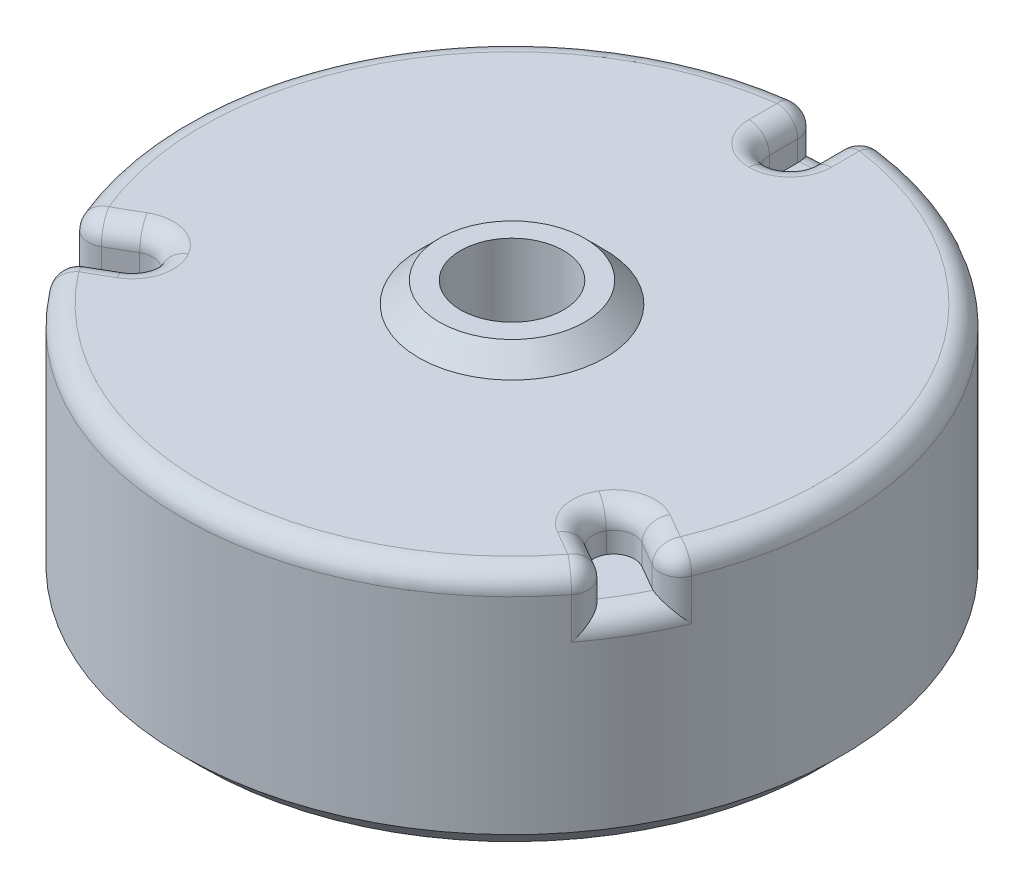
from build123d import *

# Parameters (mm, degrees)
SKETCH_1_R                       = 80
SKETCH_1_R_2                     = 12.5
EXTRUDE_1_DEPTH                  = 60
SKETCH_2_R                       = 22.637861394
SKETCH_2_R_2                     = 12.5
EXTRUDE_2_DEPTH                  = 5
CHAMFER_1_SIZE                   = 5
CHAMFER_2_SIZE                   = 5
SKETCH_3_W                       = 10
SKETCH_3_H                       = 35
CUT_EXTRUDE_1_DEPTH              = 10
FILLET_1_R                       = 5
PATTERN_CIRCULAR_1_COUNT         = 3
FILLET_1_OF_PATTERN_CIRCULAR_1_R = 5
FILLET_2_R                       = 5


# Some blends are built 0.0001 mm under size
with BuildPart() as part:
    # 草图1 → 凸台-拉伸1 (new body)
    with BuildSketch(Plane(origin=(0, 0, 0), x_dir=(1, 0, 0), z_dir=(0, 1, 0))):
        with Locations(Location((0, 0, 0), (0, 0, 270))):
            Circle(SKETCH_1_R)
        with Locations(Location((0, 0, 0), (0, 0, 270))):
            Circle(SKETCH_1_R_2, mode=Mode.SUBTRACT)
    extrude(amount=EXTRUDE_1_DEPTH)

    # 草图2 → 凸台-拉伸2 (add)
    with BuildSketch(Plane(origin=(0, 60, 0), x_dir=(1, 0, 0), z_dir=(0, 1, 0))):
        with Locations(Location((0, 0, 0), (0, 0, 270))):
            Circle(SKETCH_2_R)
        with Locations(Location((0, 0, 0), (0, 0, 270))):
            Circle(SKETCH_2_R_2, mode=Mode.SUBTRACT)
    extrude(amount=EXTRUDE_2_DEPTH)

    # 倒角1
    chamfer_1_edges = [part.edges().sort_by_distance(p)[0] for p in [
        (0, 65, -22.637861394),
    ]]
    chamfer(chamfer_1_edges, length=CHAMFER_1_SIZE - 0.0001)  # a hair under: the kernel refuses the full size

    # 倒角2
    chamfer_2_edges = [part.edges().sort_by_distance(p)[0] for p in [
        (0, 0, -80),
    ]]
    chamfer(chamfer_2_edges, length=CHAMFER_2_SIZE)

    # 草图3 → 切除-拉伸1 (cut)
    with BuildSketch(Plane(origin=(0, 60, 0), x_dir=(1, 0, 0), z_dir=(0, 1, 0))):
        with Locations((0, 80)):
            Rectangle(SKETCH_3_W, SKETCH_3_H)
    cut_extrude_1 = extrude(amount=-CUT_EXTRUDE_1_DEPTH, mode=Mode.SUBTRACT)

    # 圆角1
    # the kernel refuses this fillet: 5 mm, written as the material it adds along each edge
    with BuildSketch(Plane(origin=(5, 60, -62.5), x_dir=(0, 0, -1), z_dir=(0, -1, 0))) as fillet_1_piece_1:
        with BuildLine():
            CenterArc((FILLET_1_R, -FILLET_1_R), FILLET_1_R, 90, 90)
            Line((0, -FILLET_1_R), (0, 0))
            Line((0, 0), (FILLET_1_R, 0))
        make_face()
    extrude(amount=22.5)
    with BuildSketch(Plane(origin=(-5, 60, -62.5), x_dir=(0, 0, -1), z_dir=(0, -1, 0))) as fillet_1_piece_2:
        with BuildLine():
            CenterArc((FILLET_1_R, FILLET_1_R), FILLET_1_R, 180, 90)
            Line((0, FILLET_1_R), (0, 0))
            Line((0, 0), (FILLET_1_R, 0))
        make_face()
    extrude(amount=22.5)
    # the kernel refuses this fillet: 5 mm, written as the material it takes off along each edge
    with BuildSketch(Plane(origin=(0, 50, 0), x_dir=(-0.21704975973433055, 0, -0.9761605409968533), z_dir=(-0.9761605409968533, 0, 0.21704975973433055))) as fillet_1_2_piece_1_section:
        with BuildLine():
            CenterArc((80 - FILLET_1_R, FILLET_1_R), FILLET_1_R, 270, 90)
            Line((80 - FILLET_1_R, 0), (80, 0))
            Line((80, 0), (80, FILLET_1_R))
        make_face()
    fillet_1_2_piece_1 = revolve(axis=Axis((0, 50, 0), (0, -1, 0)), revolution_arc=25.071620089, mode=Mode.PRIVATE)
    fillet_1_2_piece_1 = split(fillet_1_2_piece_1, bisect_by=Plane(origin=(5, 48.868036462, -78.815102538), z_dir=(-1, 0, 0)), keep=Keep.TOP, mode=Mode.PRIVATE)
    fillet_1_2_piece_1 = split(fillet_1_2_piece_1, bisect_by=Plane(origin=(-5, 48.868036462, -78.815102538), z_dir=(1, 0, 0)), keep=Keep.TOP, mode=Mode.PRIVATE)
    add(fillet_1_2_piece_1, mode=Mode.SUBTRACT)
    with BuildSketch(Plane(origin=(5, 74.235159008, -79.843597113), x_dir=(0.995188508885034, 0, 0.09797873127971658), z_dir=(0, -1, 0))) as fillet_1_2_piece_2:
        with BuildLine():
            CenterArc((5.516124116, 4.996832751), FILLET_1_R, 174.37721132, 97.662255661)
            Line((0.540181571, 5.486726407), (0, 0))
            ThreePointArc((0, 0), (2.847031802, -0.050675988), (5.694063603, 0))
        make_face()
    extrude(amount=24.235159008, mode=Mode.SUBTRACT)
    with BuildSketch(Plane(origin=(-5, 74.235159008, -79.843597113), x_dir=(-0.9951885088850337, 0, 0.09797873127971717), z_dir=(0, -1, 0))) as fillet_1_2_piece_3:
        with BuildLine():
            CenterArc((5.516124116, -4.996832751), FILLET_1_R, 87.960533019, 97.662255661)
            Line((0.540181571, -5.486726407), (0, 0))
            ThreePointArc((0, 0), (2.847031802, 0.050675988), (5.694063603, 0))
        make_face()
    extrude(amount=24.235159008, mode=Mode.SUBTRACT)
    with BuildSketch(Plane(origin=(-5, 74.235159008, -79.843597113), x_dir=(-0.9951885088850337, 0, 0.09797873127971717), z_dir=(0, -1, 0))) as fillet_1_2_piece_4a_section:
        with BuildLine():
            CenterArc((5.516124116, -4.996832751), FILLET_1_R, 87.960533019, 97.662255661)
            Line((0.540181571, -5.486726407), (0, 0))
            ThreePointArc((0, 0), (2.847031802, 0.050675988), (5.694063603, 0))
        make_face()
    fillet_1_2_piece_4a = extrude(amount=38.470318016, mode=Mode.PRIVATE)
    fillet_1_2_piece_4a = split(fillet_1_2_piece_4a, bisect_by=Plane(origin=(-6.303094147, 50, -78.486698353), z_dir=(0, -1, 0)), keep=Keep.TOP, mode=Mode.PRIVATE)
    with BuildSketch(Plane(origin=(0, 50, 0), x_dir=(-0.21704975973433055, 0, -0.9761605409968533), z_dir=(-0.9761605409968533, 0, 0.21704975973433055))) as fillet_1_2_piece_4b_section:
        with BuildLine():
            CenterArc((80 - FILLET_1_R, FILLET_1_R), FILLET_1_R, 270, 90)
            Line((80 - FILLET_1_R, 0), (80, 0))
            Line((80, 0), (80, FILLET_1_R))
        make_face()
    fillet_1_2_piece_4b = revolve(axis=Axis((0, 50, 0), (0, -1, 0)), revolution_arc=25.071620089, mode=Mode.PRIVATE)
    fillet_1_2_piece_4b = split(fillet_1_2_piece_4b, bisect_by=Plane(origin=(-5, 48.855762225, -78.026154308), z_dir=(-1, 0, 0)), keep=Keep.TOP, mode=Mode.PRIVATE)
    fillet_1_2_piece_4 = fillet_1_2_piece_4a & fillet_1_2_piece_4b
    add(fillet_1_2_piece_4, mode=Mode.SUBTRACT)
    with BuildSketch(Plane(origin=(0, 50, 0), x_dir=(-0.21704975973433055, 0, -0.9761605409968533), z_dir=(-0.9761605409968533, 0, 0.21704975973433055))) as fillet_1_2_piece_5a_section:
        with BuildLine():
            CenterArc((80 - FILLET_1_R, FILLET_1_R), FILLET_1_R, 270, 90)
            Line((80 - FILLET_1_R, 0), (80, 0))
            Line((80, 0), (80, FILLET_1_R))
        make_face()
    fillet_1_2_piece_5a = revolve(axis=Axis((0, 50, 0), (0, -1, 0)), revolution_arc=25.071620089, mode=Mode.PRIVATE)
    fillet_1_2_piece_5a = split(fillet_1_2_piece_5a, bisect_by=Plane(origin=(5, 48.855762126, -78.026154496), z_dir=(1, 0, 0)), keep=Keep.TOP, mode=Mode.PRIVATE)
    with BuildSketch(Plane(origin=(5, 74.235159008, -79.843597113), x_dir=(0.995188508885034, 0, 0.09797873127971658), z_dir=(0, -1, 0))) as fillet_1_2_piece_5b_section:
        with BuildLine():
            CenterArc((5.516124116, 4.996832751), FILLET_1_R, 174.37721132, 97.662255661)
            Line((0.540181571, 5.486726407), (0, 0))
            ThreePointArc((0, 0), (2.847031802, -0.050675988), (5.694063603, 0))
        make_face()
    fillet_1_2_piece_5b = extrude(amount=38.470318016, mode=Mode.PRIVATE)
    fillet_1_2_piece_5b = split(fillet_1_2_piece_5b, bisect_by=Plane(origin=(6.303094147, 50, -78.486698353), z_dir=(0, -1, 0)), keep=Keep.TOP, mode=Mode.PRIVATE)
    fillet_1_2_piece_5 = fillet_1_2_piece_5a & fillet_1_2_piece_5b
    add(fillet_1_2_piece_5, mode=Mode.SUBTRACT)

    # 阵列(圆周)1: 切除-拉伸1 ×3 about axis
    pattern_circular_1_axis = Axis((0, 0, 0), (0, 1, 0))
    for i in range(1, PATTERN_CIRCULAR_1_COUNT):
        add(cut_extrude_1.rotate(pattern_circular_1_axis, i * 360 / PATTERN_CIRCULAR_1_COUNT), mode=Mode.SUBTRACT)

    # 圆角1 of 阵列(圆周)1
    # the kernel refuses this fillet: 5 mm, written as the material it adds along each edge
    with BuildSketch(Plane(origin=(-56.626587737, 60, 26.919872981), x_dir=(0.4999999999999999, 0, 0.8660254037844387), z_dir=(0, -1, 0)), Plane(origin=(-51.626587737, 60, 35.580127019), x_dir=(-0.8660254037844385, 0, 0.5000000000000002), z_dir=(0, -1, 0)), Plane(origin=(51.626587737, 60, 35.580127019), x_dir=(0.5000000000000002, 0, -0.8660254037844385), z_dir=(0, -1, 0)), Plane(origin=(56.626587737, 60, 26.919872981), x_dir=(0.8660254037844382, 0, 0.5000000000000007), z_dir=(0, -1, 0))) as fillet_1_of_pattern_circular_1_piece_1:
        with BuildLine():
            CenterArc((FILLET_1_OF_PATTERN_CIRCULAR_1_R, FILLET_1_OF_PATTERN_CIRCULAR_1_R), FILLET_1_OF_PATTERN_CIRCULAR_1_R, 180, 90)
            Line((0, FILLET_1_OF_PATTERN_CIRCULAR_1_R), (0, 0))
            Line((0, 0), (FILLET_1_OF_PATTERN_CIRCULAR_1_R, 0))
        make_face()
    extrude(amount=22.5)
    # the kernel refuses this fillet: 5 mm, written as the material it takes off along each edge
    with BuildSketch(Plane(origin=(0, 50, 0), x_dir=(-0.7368549468080707, 0, 0.6760508763136656), z_dir=(0.6760508763136656, 0, 0.7368549468080707))) as fillet_1_of_pattern_circular_1_2_piece_1_section:
        with BuildLine():
            CenterArc((80 - FILLET_1_OF_PATTERN_CIRCULAR_1_R, FILLET_1_OF_PATTERN_CIRCULAR_1_R), FILLET_1_OF_PATTERN_CIRCULAR_1_R, 270, 90)
            Line((80 - FILLET_1_OF_PATTERN_CIRCULAR_1_R, 0), (80, 0))
            Line((80, 0), (80, FILLET_1_OF_PATTERN_CIRCULAR_1_R))
        make_face()
    fillet_1_of_pattern_circular_1_2_piece_1 = revolve(axis=Axis((0, 50, 0), (0, -1, 0)), revolution_arc=25.071620089, mode=Mode.PRIVATE)
    fillet_1_of_pattern_circular_1_2_piece_1 = split(fillet_1_of_pattern_circular_1_2_piece_1, bisect_by=Plane(origin=(-70.755881, 48.868036462, 35.07742425), z_dir=(0.49999999999999994, 0, 0.8660254037844389)), keep=Keep.TOP, mode=Mode.PRIVATE)
    fillet_1_of_pattern_circular_1_2_piece_1 = split(fillet_1_of_pattern_circular_1_2_piece_1, bisect_by=Plane(origin=(-65.755881, 48.868036462, 43.737678288), z_dir=(-0.49999999999999994, 0, -0.8660254037844387)), keep=Keep.TOP, mode=Mode.PRIVATE)
    add(fillet_1_of_pattern_circular_1_2_piece_1, mode=Mode.SUBTRACT)
    with BuildSketch(Plane(origin=(-71.64658343, 74.235159008, 35.591671538), x_dir=(-0.4127421841237098, 0, -0.9108478958886547), z_dir=(0, -1, 0)), Plane(origin=(66.64658343, 74.235159008, 44.251925576), x_dir=(-0.5824463247613232, 0, 0.8128691646089347), z_dir=(0, -1, 0))) as fillet_1_of_pattern_circular_1_2_piece_2:
        with BuildLine():
            CenterArc((5.516124116, 4.996832751), FILLET_1_OF_PATTERN_CIRCULAR_1_R, 174.37721132, 97.662255661)
            Line((0.540181571, 5.486726407), (0, 0))
            ThreePointArc((0, 0), (2.847031802, -0.050675988), (5.694063603, 0))
        make_face()
    extrude(amount=24.235159008, mode=Mode.SUBTRACT)
    with BuildSketch(Plane(origin=(-66.64658343, 74.235159008, 44.251925576), x_dir=(0.582446324761323, 0, 0.8128691646089348), z_dir=(0, -1, 0)), Plane(origin=(71.64658343, 74.235159008, 35.591671538), x_dir=(0.41274218412371083, 0, -0.9108478958886541), z_dir=(0, -1, 0))) as fillet_1_of_pattern_circular_1_2_piece_3:
        with BuildLine():
            CenterArc((5.516124116, -4.996832751), FILLET_1_OF_PATTERN_CIRCULAR_1_R, 87.960533019, 97.662255661)
            Line((0.540181571, -5.486726407), (0, 0))
            ThreePointArc((0, 0), (2.847031802, 0.050675988), (5.694063603, 0))
        make_face()
    extrude(amount=24.235159008, mode=Mode.SUBTRACT)
    with BuildSketch(Plane(origin=(0, 50, 0), x_dir=(0.9539047065424011, 0, 0.3001096646831883), z_dir=(0.3001096646831883, 0, -0.9539047065424011))) as fillet_1_of_pattern_circular_1_2_piece_4_section:
        with BuildLine():
            CenterArc((80 - FILLET_1_OF_PATTERN_CIRCULAR_1_R, FILLET_1_OF_PATTERN_CIRCULAR_1_R), FILLET_1_OF_PATTERN_CIRCULAR_1_R, 270, 90)
            Line((80 - FILLET_1_OF_PATTERN_CIRCULAR_1_R, 0), (80, 0))
            Line((80, 0), (80, FILLET_1_OF_PATTERN_CIRCULAR_1_R))
        make_face()
    fillet_1_of_pattern_circular_1_2_piece_4 = revolve(axis=Axis((0, 50, 0), (0, -1, 0)), revolution_arc=25.071620089, mode=Mode.PRIVATE)
    fillet_1_of_pattern_circular_1_2_piece_4 = split(fillet_1_of_pattern_circular_1_2_piece_4, bisect_by=Plane(origin=(65.755881, 48.868036462, 43.737678288), z_dir=(0.5000000000000004, 0, -0.8660254037844385)), keep=Keep.TOP, mode=Mode.PRIVATE)
    fillet_1_of_pattern_circular_1_2_piece_4 = split(fillet_1_of_pattern_circular_1_2_piece_4, bisect_by=Plane(origin=(70.755881, 48.868036462, 35.07742425), z_dir=(-0.5000000000000003, 0, 0.8660254037844385)), keep=Keep.TOP, mode=Mode.PRIVATE)
    add(fillet_1_of_pattern_circular_1_2_piece_4, mode=Mode.SUBTRACT)
    with BuildSketch(Plane(origin=(-66.64658343, 74.235159008, 44.251925576), x_dir=(0.582446324761323, 0, 0.8128691646089348), z_dir=(0, -1, 0))) as fillet_1_of_pattern_circular_1_2_piece_5a_section:
        with BuildLine():
            CenterArc((5.516124116, -4.996832751), FILLET_1_OF_PATTERN_CIRCULAR_1_R, 87.960533019, 97.662255661)
            Line((0.540181571, -5.486726407), (0, 0))
            ThreePointArc((0, 0), (2.847031802, 0.050675988), (5.694063603, 0))
        make_face()
    fillet_1_of_pattern_circular_1_2_piece_5a = extrude(amount=38.470318016, mode=Mode.PRIVATE)
    fillet_1_of_pattern_circular_1_2_piece_5a = split(fillet_1_of_pattern_circular_1_2_piece_5a, bisect_by=Plane(origin=(-64.81992756, 50, 44.70198883), z_dir=(0, -1, 0)), keep=Keep.TOP, mode=Mode.PRIVATE)
    with BuildSketch(Plane(origin=(0, 50, 0), x_dir=(-0.7368549468080707, 0, 0.6760508763136656), z_dir=(0.6760508763136656, 0, 0.7368549468080707))) as fillet_1_of_pattern_circular_1_2_piece_5b_section:
        with BuildLine():
            CenterArc((80 - FILLET_1_OF_PATTERN_CIRCULAR_1_R, FILLET_1_OF_PATTERN_CIRCULAR_1_R), FILLET_1_OF_PATTERN_CIRCULAR_1_R, 270, 90)
            Line((80 - FILLET_1_OF_PATTERN_CIRCULAR_1_R, 0), (80, 0))
            Line((80, 0), (80, FILLET_1_OF_PATTERN_CIRCULAR_1_R))
        make_face()
    fillet_1_of_pattern_circular_1_2_piece_5b = revolve(axis=Axis((0, 50, 0), (0, -1, 0)), revolution_arc=25.071620089, mode=Mode.PRIVATE)
    fillet_1_of_pattern_circular_1_2_piece_5b = split(fillet_1_of_pattern_circular_1_2_piece_5b, bisect_by=Plane(origin=(-65.072631791, 48.855762225, 43.343204173), z_dir=(0.49999999999999994, 0, 0.8660254037844387)), keep=Keep.TOP, mode=Mode.PRIVATE)
    fillet_1_of_pattern_circular_1_2_piece_5 = fillet_1_of_pattern_circular_1_2_piece_5a & fillet_1_of_pattern_circular_1_2_piece_5b
    add(fillet_1_of_pattern_circular_1_2_piece_5, mode=Mode.SUBTRACT)
    with BuildSketch(Plane(origin=(0, 50, 0), x_dir=(-0.7368549468080707, 0, 0.6760508763136656), z_dir=(0.6760508763136656, 0, 0.7368549468080707))) as fillet_1_of_pattern_circular_1_2_piece_6a_section:
        with BuildLine():
            CenterArc((80 - FILLET_1_OF_PATTERN_CIRCULAR_1_R, FILLET_1_OF_PATTERN_CIRCULAR_1_R), FILLET_1_OF_PATTERN_CIRCULAR_1_R, 270, 90)
            Line((80 - FILLET_1_OF_PATTERN_CIRCULAR_1_R, 0), (80, 0))
            Line((80, 0), (80, FILLET_1_OF_PATTERN_CIRCULAR_1_R))
        make_face()
    fillet_1_of_pattern_circular_1_2_piece_6a = revolve(axis=Axis((0, 50, 0), (0, -1, 0)), revolution_arc=25.071620089, mode=Mode.PRIVATE)
    fillet_1_of_pattern_circular_1_2_piece_6a = split(fillet_1_of_pattern_circular_1_2_piece_6a, bisect_by=Plane(origin=(-70.072631954, 48.855762126, 34.682950229), z_dir=(-0.49999999999999994, 0, -0.8660254037844389)), keep=Keep.TOP, mode=Mode.PRIVATE)
    with BuildSketch(Plane(origin=(-71.64658343, 74.235159008, 35.591671538), x_dir=(-0.4127421841237098, 0, -0.9108478958886547), z_dir=(0, -1, 0))) as fillet_1_of_pattern_circular_1_2_piece_6b_section:
        with BuildLine():
            CenterArc((5.516124116, 4.996832751), FILLET_1_OF_PATTERN_CIRCULAR_1_R, 174.37721132, 97.662255661)
            Line((0.540181571, 5.486726407), (0, 0))
            ThreePointArc((0, 0), (2.847031802, -0.050675988), (5.694063603, 0))
        make_face()
    fillet_1_of_pattern_circular_1_2_piece_6b = extrude(amount=38.470318016, mode=Mode.PRIVATE)
    fillet_1_of_pattern_circular_1_2_piece_6b = split(fillet_1_of_pattern_circular_1_2_piece_6b, bisect_by=Plane(origin=(-71.123021706, 50, 33.784709523), z_dir=(0, -1, 0)), keep=Keep.TOP, mode=Mode.PRIVATE)
    fillet_1_of_pattern_circular_1_2_piece_6 = fillet_1_of_pattern_circular_1_2_piece_6a & fillet_1_of_pattern_circular_1_2_piece_6b
    add(fillet_1_of_pattern_circular_1_2_piece_6, mode=Mode.SUBTRACT)
    with BuildSketch(Plane(origin=(71.64658343, 74.235159008, 35.591671538), x_dir=(0.41274218412371083, 0, -0.9108478958886541), z_dir=(0, -1, 0))) as fillet_1_of_pattern_circular_1_2_piece_7a_section:
        with BuildLine():
            CenterArc((5.516124116, -4.996832751), FILLET_1_OF_PATTERN_CIRCULAR_1_R, 87.960533019, 97.662255661)
            Line((0.540181571, -5.486726407), (0, 0))
            ThreePointArc((0, 0), (2.847031802, 0.050675988), (5.694063603, 0))
        make_face()
    fillet_1_of_pattern_circular_1_2_piece_7a = extrude(amount=38.470318016, mode=Mode.PRIVATE)
    fillet_1_of_pattern_circular_1_2_piece_7a = split(fillet_1_of_pattern_circular_1_2_piece_7a, bisect_by=Plane(origin=(71.123021706, 50, 33.784709523), z_dir=(0, -1, 0)), keep=Keep.TOP, mode=Mode.PRIVATE)
    with BuildSketch(Plane(origin=(0, 50, 0), x_dir=(0.9539047065424011, 0, 0.3001096646831883), z_dir=(0.3001096646831883, 0, -0.9539047065424011))) as fillet_1_of_pattern_circular_1_2_piece_7b_section:
        with BuildLine():
            CenterArc((80 - FILLET_1_OF_PATTERN_CIRCULAR_1_R, FILLET_1_OF_PATTERN_CIRCULAR_1_R), FILLET_1_OF_PATTERN_CIRCULAR_1_R, 270, 90)
            Line((80 - FILLET_1_OF_PATTERN_CIRCULAR_1_R, 0), (80, 0))
            Line((80, 0), (80, FILLET_1_OF_PATTERN_CIRCULAR_1_R))
        make_face()
    fillet_1_of_pattern_circular_1_2_piece_7b = revolve(axis=Axis((0, 50, 0), (0, -1, 0)), revolution_arc=25.071620089, mode=Mode.PRIVATE)
    fillet_1_of_pattern_circular_1_2_piece_7b = split(fillet_1_of_pattern_circular_1_2_piece_7b, bisect_by=Plane(origin=(70.072631791, 48.855762225, 34.682950135), z_dir=(0.5000000000000003, 0, -0.8660254037844385)), keep=Keep.TOP, mode=Mode.PRIVATE)
    fillet_1_of_pattern_circular_1_2_piece_7 = fillet_1_of_pattern_circular_1_2_piece_7a & fillet_1_of_pattern_circular_1_2_piece_7b
    add(fillet_1_of_pattern_circular_1_2_piece_7, mode=Mode.SUBTRACT)
    with BuildSketch(Plane(origin=(0, 50, 0), x_dir=(0.9539047065424011, 0, 0.3001096646831883), z_dir=(0.3001096646831883, 0, -0.9539047065424011))) as fillet_1_of_pattern_circular_1_2_piece_8a_section:
        with BuildLine():
            CenterArc((80 - FILLET_1_OF_PATTERN_CIRCULAR_1_R, FILLET_1_OF_PATTERN_CIRCULAR_1_R), FILLET_1_OF_PATTERN_CIRCULAR_1_R, 270, 90)
            Line((80 - FILLET_1_OF_PATTERN_CIRCULAR_1_R, 0), (80, 0))
            Line((80, 0), (80, FILLET_1_OF_PATTERN_CIRCULAR_1_R))
        make_face()
    fillet_1_of_pattern_circular_1_2_piece_8a = revolve(axis=Axis((0, 50, 0), (0, -1, 0)), revolution_arc=25.071620089, mode=Mode.PRIVATE)
    fillet_1_of_pattern_circular_1_2_piece_8a = split(fillet_1_of_pattern_circular_1_2_piece_8a, bisect_by=Plane(origin=(65.072631954, 48.855762126, 43.343204267), z_dir=(-0.5000000000000004, 0, 0.8660254037844385)), keep=Keep.TOP, mode=Mode.PRIVATE)
    with BuildSketch(Plane(origin=(66.64658343, 74.235159008, 44.251925576), x_dir=(-0.5824463247613232, 0, 0.8128691646089347), z_dir=(0, -1, 0))) as fillet_1_of_pattern_circular_1_2_piece_8b_section:
        with BuildLine():
            CenterArc((5.516124116, 4.996832751), FILLET_1_OF_PATTERN_CIRCULAR_1_R, 174.37721132, 97.662255661)
            Line((0.540181571, 5.486726407), (0, 0))
            ThreePointArc((0, 0), (2.847031802, -0.050675988), (5.694063603, 0))
        make_face()
    fillet_1_of_pattern_circular_1_2_piece_8b = extrude(amount=38.470318016, mode=Mode.PRIVATE)
    fillet_1_of_pattern_circular_1_2_piece_8b = split(fillet_1_of_pattern_circular_1_2_piece_8b, bisect_by=Plane(origin=(64.81992756, 50, 44.70198883), z_dir=(0, -1, 0)), keep=Keep.TOP, mode=Mode.PRIVATE)
    fillet_1_of_pattern_circular_1_2_piece_8 = fillet_1_of_pattern_circular_1_2_piece_8a & fillet_1_of_pattern_circular_1_2_piece_8b
    add(fillet_1_of_pattern_circular_1_2_piece_8, mode=Mode.SUBTRACT)

    # 圆角2
    fillet_2_edges = [part.edges().sort_by_distance(p)[0] for p in [
        (-63.914340352, 60, 31.127458915),
        (-58.914340352, 60, 39.787712953),
        (-64.277268622, 60, 44.856918975),
        (-70.985865679, 60, 33.237288025),
        (-54.126587737, 60, 31.25),
        (-54.126587737, 60, 31.25),
        (69.282032303, 60, -40),
        (58.914340352, 60, 39.787712953),
        (63.914340352, 60, 31.127458915),
        (70.985865679, 60, 33.237288025),
        (64.277268622, 60, 44.856918975),
        (54.126587737, 60, 31.25),
        (54.126587737, 60, 31.25),
        (-69.282032303, 60, -40),
        (5, 60, -70.915171868),
        (-5, 60, -70.915171868),
        (-6.708597057, 60, -78.094207),
        (6.708597057, 60, -78.094207),
        (0, 60, -62.5),
        (0, 60, -62.5),
        (35.281465786, 60, 71.799847994),
    ]]
    fillet(fillet_2_edges, radius=FILLET_2_R)


solid = part.part
